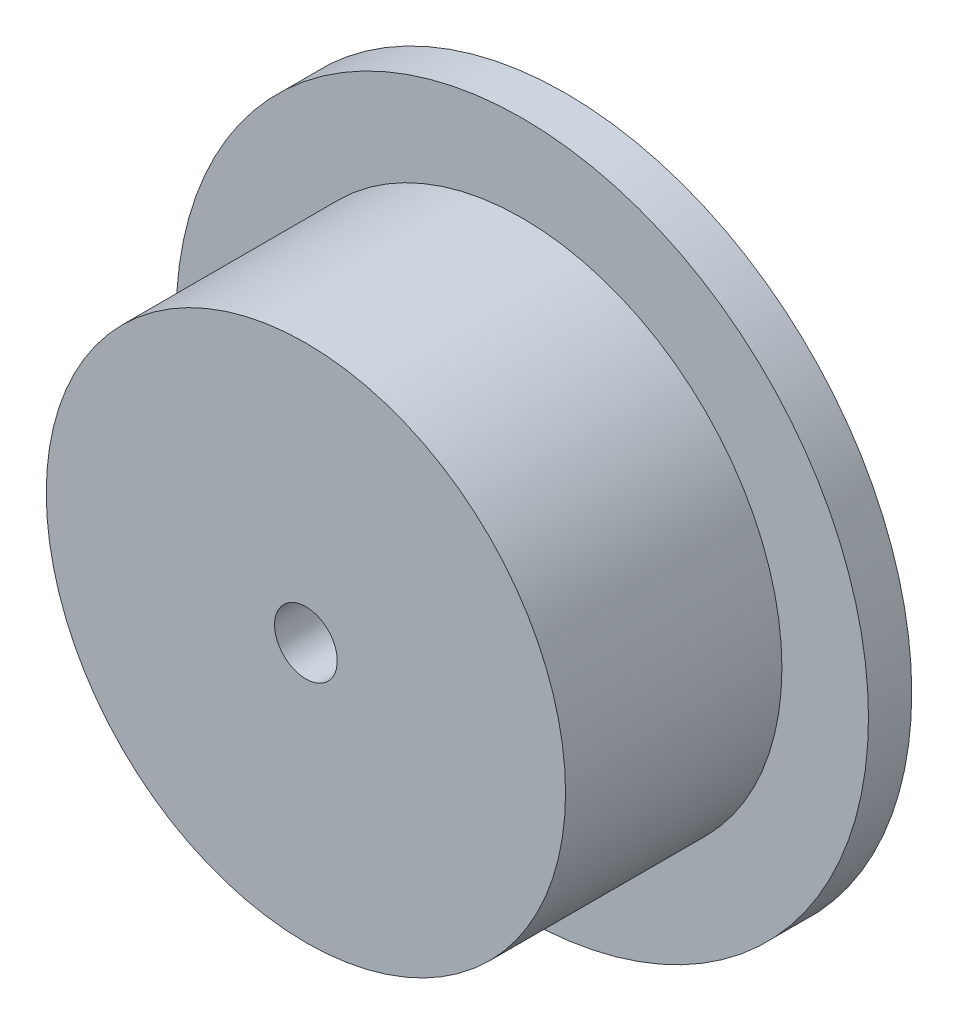
from build123d import *

# Parameters (mm, degrees)
SKETCH1_R           = 12.7
BOSS_EXTRUDE1_DEPTH = 1.5875
SKETCH2_R           = 9.525
BOSS_EXTRUDE2_DEPTH = 7.9375
SKETCH3_R           = 1.15
CUT_EXTRUDE1_DEPTH  = 21.329919454


with BuildPart() as part:
    # Sketch1 → Boss-Extrude1 (new body)
    with BuildSketch(Plane.XY):
        Circle(SKETCH1_R)
    extrude(amount=BOSS_EXTRUDE1_DEPTH)

    # Sketch2 → Boss-Extrude2 (add)
    with BuildSketch(Plane.XY.offset(1.5875)):
        Circle(SKETCH2_R)
    extrude(amount=BOSS_EXTRUDE2_DEPTH)

    # Sketch3 → Cut-Extrude1 (cut, through all)
    with BuildSketch(Plane.XY.offset(9.525)):
        Circle(SKETCH3_R)
    extrude(amount=-CUT_EXTRUDE1_DEPTH, mode=Mode.SUBTRACT)


solid = part.part
